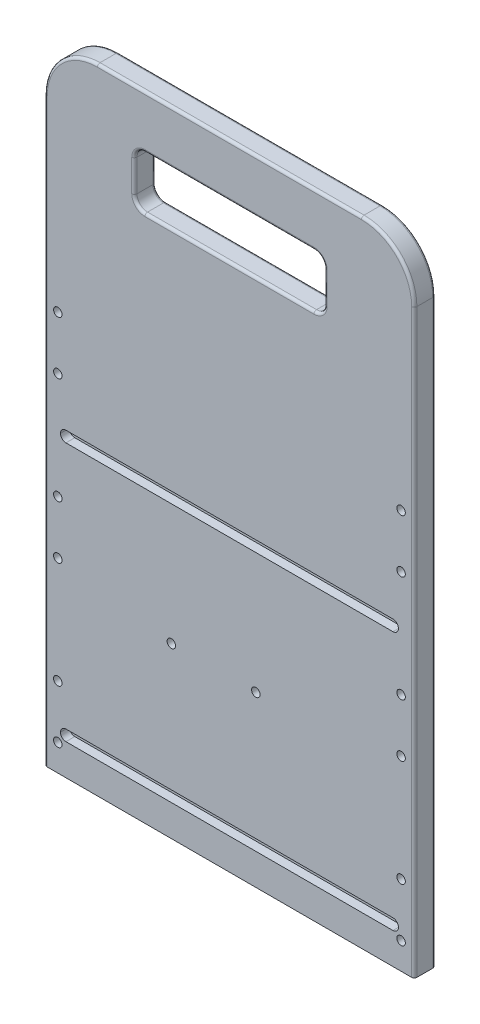
from build123d import *

# Parameters (mm, degrees)
SKETCH1_W                                       = 222.25
SKETCH1_H                                       = 381
BOSS_EXTRUDE1_DEPTH                             = 12.7
FILLET1_R                                       = 31.75
SKETCH2_W                                       = 114.3
SKETCH2_H                                       = 31.75
CUT_EXTRUDE1_DEPTH                              = 12.7
FILLET2_R                                       = 6.35
SKETCH3_W                                       = 203.2
SKETCH3_H                                       = 6.604
CUT_EXTRUDE2_DEPTH                              = 5.334
FILLET3_R                                       = 3.302
CSK_FOR_10_FLAT_HEAD_MACHINE_SCREW1_D           = 5.1054
CSK_FOR_10_FLAT_HEAD_MACHINE_SCREW1_CSINK_D     = 9.779
CSK_FOR_10_FLAT_HEAD_MACHINE_SCREW1_CSINK_ANGLE = 82
FILLET4_R                                       = 1.5875


with BuildPart() as part:
    # Sketch1 → Boss-Extrude1 (new body)
    with BuildSketch(Plane.XY):
        Rectangle(SKETCH1_W, SKETCH1_H)
    extrude(amount=BOSS_EXTRUDE1_DEPTH)

    # Fillet1
    fillet1_edges = [part.edges().sort_by_distance(p)[0] for p in [
        (111.125, 190.5, 6.35),
        (-111.125, 190.5, 6.35),
    ]]
    fillet(fillet1_edges, radius=FILLET1_R)

    # Sketch2 → Cut-Extrude1 (cut)
    with BuildSketch(Plane.XY.offset(12.7)):
        with Locations((0, 142.875)):
            Rectangle(SKETCH2_W, SKETCH2_H)
    extrude(amount=-CUT_EXTRUDE1_DEPTH, mode=Mode.SUBTRACT)

    # Fillet2
    fillet2_edges = [part.edges().sort_by_distance(p)[0] for p in [
        (57.15, 127, 6.35),
        (57.15, 158.75, 6.35),
        (-57.15, 158.75, 6.35),
        (-57.15, 127, 6.35),
    ]]
    fillet(fillet2_edges, radius=FILLET2_R)

    # Sketch3 → Cut-Extrude2 (cut)
    with BuildSketch(Plane.XY.offset(12.7)):
        with Locations((0, -168.402)):
            Rectangle(SKETCH3_W, SKETCH3_H)
        with Locations((0, -12.827)):
            Rectangle(SKETCH3_W, SKETCH3_H)
    extrude(amount=-CUT_EXTRUDE2_DEPTH, mode=Mode.SUBTRACT)

    # Fillet3
    fillet3_edges = [part.edges().sort_by_distance(p)[0] for p in [
        (101.6, -165.1, 10.033),
        (101.6, -171.704, 10.033),
        (-101.6, -171.704, 10.033),
        (-101.6, -165.1, 10.033),
        (101.6, -16.129, 10.033),
        (101.6, -9.525, 10.033),
        (-101.6, -9.525, 10.033),
        (-101.6, -16.129, 10.033),
    ]]
    fillet(fillet3_edges, radius=FILLET3_R - 0.0001)  # a hair under: the kernel refuses the full size

    # CSK for #10 Flat Head Machine Screw1 (through all)
    with Locations(Plane(origin=(0, 0, 0), x_dir=(-1, 0, 0), z_dir=(0, 0, -1))):
        with Locations((-103.1875, -174.499999996), (103.1875, -174.499999996), (-15.875, -88.9), (34.925, -88.9), (-103.1875, -142.499999988), (103.1875, -142.499999988), (-103.1875, -78.499999972), (103.1875, -78.499999972), (-103.1875, -46.499999964), (103.1875, -46.499999964), (-103.1875, 17.500000052), (103.1875, 17.500000052), (-103.1875, 49.50000006), (103.1875, 49.50000006)):
            CounterSinkHole(CSK_FOR_10_FLAT_HEAD_MACHINE_SCREW1_D / 2, CSK_FOR_10_FLAT_HEAD_MACHINE_SCREW1_CSINK_D / 2, counter_sink_angle=CSK_FOR_10_FLAT_HEAD_MACHINE_SCREW1_CSINK_ANGLE)

    # Fillet4
    fillet4_edges = [part.edges().sort_by_distance(p)[0] for p in [
        (111.125, -15.875, 12.7),
        (0, 190.5, 0),
        (101.825640303, 181.200640303, 0),
        (-101.825640303, 181.200640303, 0),
        (0, 190.5, 12.7),
        (101.825640303, 181.200640303, 12.7),
        (-101.825640303, 181.200640303, 12.7),
        (-111.125, -15.875, 12.7),
        (57.15, 142.875, 12.7),
        (57.15, 142.875, 0),
        (0, 127, 12.7),
        (0, 127, 0),
        (0, 158.75, 12.7),
        (0, 158.75, 0),
        (-57.15, 142.875, 12.7),
        (-57.15, 142.875, 0),
        (111.125, -15.875, 0),
        (55.290128061, 128.859871939, 12.7),
        (55.290128061, 128.859871939, 0),
        (55.290128061, 156.890128061, 12.7),
        (55.290128061, 156.890128061, 0),
        (-55.290128061, 156.890128061, 12.7),
        (-55.290128061, 156.890128061, 0),
        (-55.290128061, 128.859871939, 12.7),
        (-55.290128061, 128.859871939, 0),
        (-111.125, -15.875, 0),
    ]]
    fillet(fillet4_edges, radius=FILLET4_R)


solid = part.part
